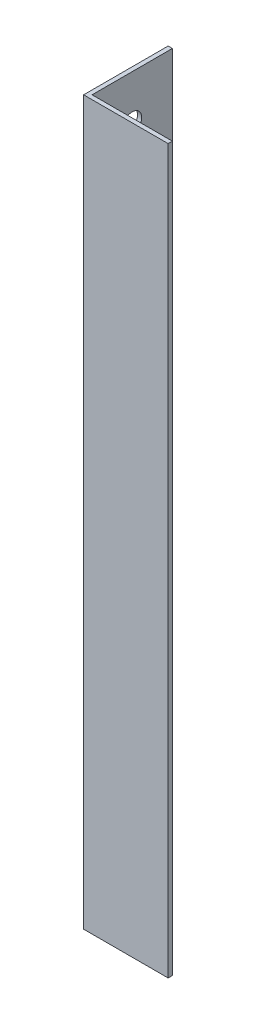
from build123d import *

# Parameters (mm, degrees)
EXTRUDE_1_DEPTH     = 171
SKETCH_2_R          = 2.25
CUT_EXTRUDE_1_DEPTH = 174.210854163


with BuildPart() as part:
    # Эскиз1 → Бобышка-Вытянуть1 (new body)
    with BuildSketch(Plane(origin=(0, 0, 0), x_dir=(1, 0, 0), z_dir=(0, 1, 0))):
        Polygon((0, 0), (0, 20), (1, 20), (1, 1), (20, 1), (20, 0), align=None)
    extrude(amount=EXTRUDE_1_DEPTH)

    # Эскиз2 → Вырез-Вытянуть1 (cut, through all)
    with BuildSketch(Plane(origin=(1, 0, 0), x_dir=(0, 0, -1), z_dir=(1, 0, 0))):
        with Locations((10.5, 9.5)):
            Circle(SKETCH_2_R)
        with Locations((10.5, 160.5)):
            Circle(SKETCH_2_R)
    extrude(amount=-CUT_EXTRUDE_1_DEPTH, mode=Mode.SUBTRACT)


solid = part.part
